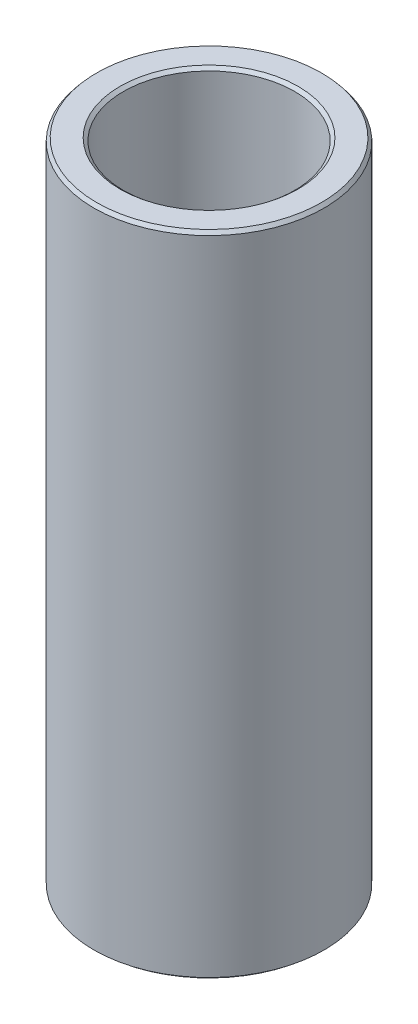
from build123d import *
from OCP.BRepFilletAPI import BRepFilletAPI_MakeChamfer

# Parameters (mm, degrees)
SKETCH1_R           = 30
BOSS_EXTRUDE1_DEPTH = 169.010100024
SKETCH2_R           = 22.325280957
CUT_EXTRUDE1_DEPTH  = 175.253877748
CHAMFER1_SIZE       = 0.876014595
CHAMFER1_SIZE2      = 0.72094581


with BuildPart() as part:
    # Sketch1 → Boss-Extrude1 (new body)
    with BuildSketch(Plane(origin=(0, 0, 0), x_dir=(1, 0, 0), z_dir=(0, 1, 0))):
        Circle(SKETCH1_R)
    extrude(amount=BOSS_EXTRUDE1_DEPTH)

    # Sketch2 → Cut-Extrude1 (cut, through all)
    with BuildSketch(Plane(origin=(0, 0, 0), x_dir=(1, 0, 0), z_dir=(0, 1, 0))):
        Circle(SKETCH2_R)
    extrude(amount=CUT_EXTRUDE1_DEPTH, mode=Mode.SUBTRACT)

    # Chamfer1: one chamfer whose edges measure the first distance from different faces: ONE call of the kernel's chamfer builder (chamfer() names one face for all edges)
    chamfer1_edges_1 = [part.edges().sort_by_distance(p)[0] for p in [
        (-22.325280957, 169.010100024, 0),
    ]]
    chamfer1_side_1 = [part.faces().sort_by_distance(p)[0] for p in [
        (-29.151471863, 169.010100024, 0),
    ]]
    chamfer1_edges_2 = [part.edges().sort_by_distance(p)[0] for p in [
        (-22.325280957, 0, 0),
    ]]
    chamfer1_side_2 = [part.faces().sort_by_distance(p)[0] for p in [
        (-22.325280957, 84.505050012, 0),
    ]]
    chamfer1_edges_3 = [part.edges().sort_by_distance(p)[0] for p in [
        (-30, 0, 0),
    ]]
    chamfer1_side_3 = [part.faces().sort_by_distance(p)[0] for p in [
        (-29.151471863, 0, 0),
    ]]
    chamfer1_edges_4 = [part.edges().sort_by_distance(p)[0] for p in [
        (-30, 169.010100024, 0),
    ]]
    chamfer1_side_4 = [part.faces().sort_by_distance(p)[0] for p in [
        (-30, 84.505050012, 0),
    ]]
    chamfer1 = BRepFilletAPI_MakeChamfer(part.part.solid().wrapped)
    for e in chamfer1_edges_1:
        chamfer1.Add(CHAMFER1_SIZE, CHAMFER1_SIZE2, e.wrapped, chamfer1_side_1[0].wrapped)  # the first distance lies on this face
    for e in chamfer1_edges_2:
        chamfer1.Add(CHAMFER1_SIZE, CHAMFER1_SIZE2, e.wrapped, chamfer1_side_2[0].wrapped)  # the first distance lies on this face
    for e in chamfer1_edges_3:
        chamfer1.Add(CHAMFER1_SIZE, CHAMFER1_SIZE2, e.wrapped, chamfer1_side_3[0].wrapped)  # the first distance lies on this face
    for e in chamfer1_edges_4:
        chamfer1.Add(CHAMFER1_SIZE, CHAMFER1_SIZE2, e.wrapped, chamfer1_side_4[0].wrapped)  # the first distance lies on this face
    add(Compound.cast(chamfer1.Shape()), mode=Mode.REPLACE)


solid = part.part
